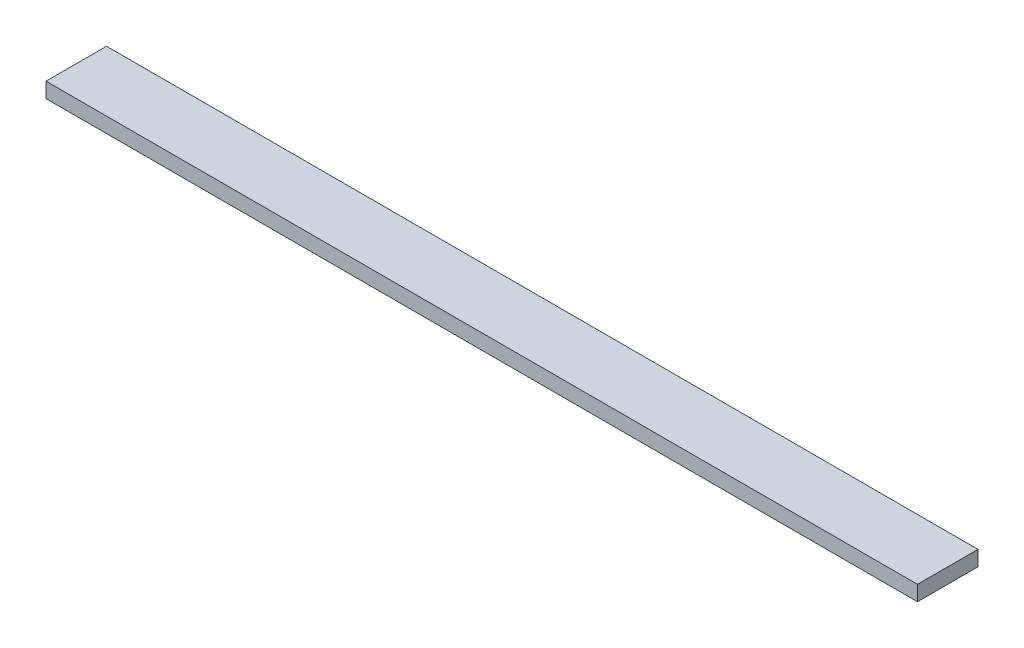
from build123d import *

# Parameters (mm, degrees)
SKETCH1_W           = 914.4
SKETCH1_H           = 63.5
BOSS_EXTRUDE1_DEPTH = 15.875


with BuildPart() as part:
    # Sketch1 → Boss-Extrude1 (new body)
    with BuildSketch(Plane(origin=(0, 0, 0), x_dir=(1, 0, 0), z_dir=(0, 1, 0))):
        with Locations((457.2, 31.75)):
            Rectangle(SKETCH1_W, SKETCH1_H)
    extrude(amount=BOSS_EXTRUDE1_DEPTH)


solid = part.part
